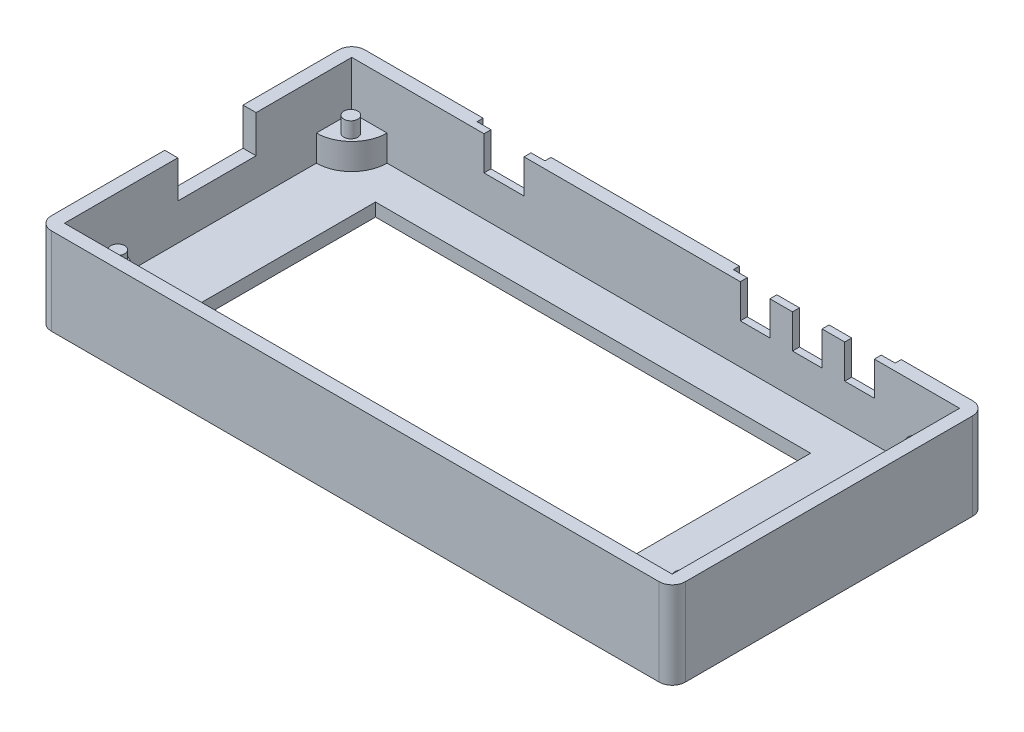
from build123d import *

# Parameters (mm, degrees)
EXTRUDE_1_DEPTH         = 1.5
CUT_EXTRUDE_2_REACH     = 41.107
SKETCH_1_6_W            = 50
SKETCH_1_6_H            = 24.956
EXTRUDE_1_2_OUTLINE_W   = 72.855
EXTRUDE_1_2_OUTLINE_H   = 36.02
EXTRUDE_1_2_OUTLINE_W_2 = 69.855
EXTRUDE_1_2_OUTLINE_H_2 = 33.02
EXTRUDE_1_2_DEPTH       = 10
FILLET_1_R              = 1.5
EXTRUDE_2_DEPTH         = 3
SKETCH_3_R              = 0.8
EXTRUDE_3_DEPTH         = 1.8
CUT_EXTRUDE_3_REACH     = 76.522
SKETCH_4_W              = 9
SKETCH_4_H              = 4.3
CUT_EXTRUDE_4_REACH     = 53.172
SKETCH_5_W              = 3.4
SKETCH_5_H              = 4
SKETCH_5_W_2            = 4.6
CUT_EXTRUDE_START       = -1.5
SKETCH_5_6_W            = 7.8
SKETCH_5_6_H            = 7.2
SKETCH_5_6_W_2          = 18.6
CUT_EXTRUDE_6_DEPTH     = 0.7


# Read off the part's stored shape, not the designer's step: 拉伸-薄壁1
with BuildPart() as part:
    # 草图1 → Extrude 1 (new body)
    with BuildSketch(Plane(origin=(0, 0, 0), x_dir=(1, 0, 0), z_dir=(0, 1, 0))):
        Polygon((-34.9275, 15.494), (34.9275, 15.494), (34.9275, -15.494), (34.9275, -17.526), (-34.9275, -17.526), (-34.9275, -15.494), align=None)
    extrude(amount=EXTRUDE_1_DEPTH)

    # 草图1<6> → 切除-拉伸2 (cut, up to next)
    with BuildSketch(Plane(origin=(0, 0, 0), x_dir=(1, 0, 0), z_dir=(0, 1, 0)), mode=Mode.PRIVATE) as cut_extrude_2_sk1:
        with Locations((-2.6635, -1.516)):
            Rectangle(SKETCH_1_6_W, SKETCH_1_6_H)
    cut_extrude_2_tool1 = extrude(cut_extrude_2_sk1.sketch, amount=CUT_EXTRUDE_2_REACH, mode=Mode.PRIVATE) & part.part
    add(cut_extrude_2_tool1.solids().sort_by_distance((-2.6635, 0, 1.516))[0], mode=Mode.SUBTRACT)



with BuildPart() as body_2:
    # Extrude 1 2 outline → Extrude 1 2 (new body)
    with BuildSketch(Plane(origin=(0, 0, 0), x_dir=(1, 0, 0), z_dir=(0, 1, 0))):
        with Locations((0, -1.016)):
            Rectangle(EXTRUDE_1_2_OUTLINE_W, EXTRUDE_1_2_OUTLINE_H)
        with Locations((0, -1.016)):
            Rectangle(EXTRUDE_1_2_OUTLINE_W_2, EXTRUDE_1_2_OUTLINE_H_2, mode=Mode.SUBTRACT)
    extrude(amount=EXTRUDE_1_2_DEPTH)

    # 圆角1
    fillet_1_edges = [body_2.edges().sort_by_distance(p)[0] for p in [
        (-36.4275, 5, -16.994),
        (-36.4275, 5, 19.026),
        (36.4275, 5, 19.026),
        (36.4275, 5, -16.994),
    ]]
    fillet(fillet_1_edges, radius=FILLET_1_R)


with BuildPart() as part_1:
    add(part.part)

    add(body_2.part)  # 凸台-拉伸2 merges body 2
    # 草图2 → 凸台-拉伸2 (add)
    with BuildSketch(Plane(origin=(0, 1.5, 0), x_dir=(1, 0, 0), z_dir=(0, 1, 0))):
        with BuildLine():
            ThreePointArc((-31.407972759, -17.526), (-31.407972759, -13.462), (-34.9275, -11.43))
            Line((-34.9275, -11.43), (-34.9275, -17.526))
            Line((-34.9275, -17.526), (-31.407972759, -17.526))
        make_face()
        with BuildLine():
            ThreePointArc((-34.9275, 11.43), (-32.053818041, 12.620318041), (-30.8635, 15.494))
            Line((-30.8635, 15.494), (-34.9275, 15.494))
            Line((-34.9275, 15.494), (-34.9275, 11.43))
        make_face()
        with BuildLine():
            Line((34.9275, 15.494), (29.8635, 15.494))
            ThreePointArc((29.8635, 15.494), (31.34671126, 11.91321126), (34.9275, 10.43))
            Line((34.9275, 10.43), (34.9275, 15.494))
        make_face()
        with BuildLine():
            Line((34.9275, -17.526), (34.9275, -10.43))
            ThreePointArc((34.9275, -10.43), (30.688741691, -12.723255696), (30.289065781, -17.526))
            Line((30.289065781, -17.526), (34.9275, -17.526))
        make_face()
    extrude(amount=EXTRUDE_2_DEPTH)

    # 草图3 → 凸台-拉伸3 (add)
    with BuildSketch(Plane(origin=(0, 4.5, 0), x_dir=(1, 0, 0), z_dir=(0, 1, 0))):
        with Locations(Location((-32.9275, -13.394, 0), (0, 0, 270))):
            Circle(SKETCH_3_R)
        with Locations(Location((-32.9275, 13.394, 0), (0, 0, 90))):
            Circle(SKETCH_3_R)
        with Locations(Location((31.9275, -13.394, 0), (0, 0, 90))):
            Circle(SKETCH_3_R)
        with Locations(Location((31.9275, 13.394, 0), (0, 0, 270))):
            Circle(SKETCH_3_R)
    extrude(amount=EXTRUDE_3_DEPTH)

    # 草图4 → 切除-拉伸3 (cut, up to next)
    with BuildSketch(Plane(origin=(-34.9275, 0, 0), x_dir=(0, 0, -1), z_dir=(1, 0, 0)), mode=Mode.PRIVATE) as cut_extrude_3_sk1:
        with Locations((0, 7.85)):
            Rectangle(SKETCH_4_W, SKETCH_4_H)
    cut_extrude_3_tool1 = extrude(cut_extrude_3_sk1.sketch, amount=-CUT_EXTRUDE_3_REACH, mode=Mode.PRIVATE) & part_1.part
    add(cut_extrude_3_tool1.solids().sort_by_distance((-34.9275, 7.85, 0))[0], mode=Mode.SUBTRACT)

    # 草图5 → 切除-拉伸4 (cut, up to next)
    with BuildSketch(Plane.XY.offset(-15.494), mode=Mode.PRIVATE) as cut_extrude_4_sk1:
        with Locations((11.4275, 8.1)):
            Rectangle(SKETCH_5_W, SKETCH_5_H)
    cut_extrude_4_tool1 = extrude(cut_extrude_4_sk1.sketch, amount=-CUT_EXTRUDE_4_REACH, mode=Mode.PRIVATE) & part_1.part
    # 草图5 → 切除-拉伸4 (cut, up to next)
    with BuildSketch(Plane.XY.offset(-15.494), mode=Mode.PRIVATE) as cut_extrude_4_sk2:
        with Locations((17.4275, 8.1)):
            Rectangle(SKETCH_5_W, SKETCH_5_H)
    cut_extrude_4_tool2 = extrude(cut_extrude_4_sk2.sketch, amount=-CUT_EXTRUDE_4_REACH, mode=Mode.PRIVATE) & part_1.part
    # 草图5 → 切除-拉伸4 (cut, up to next)
    with BuildSketch(Plane.XY.offset(-15.494), mode=Mode.PRIVATE) as cut_extrude_4_sk3:
        with Locations((23.4275, 8.1)):
            Rectangle(SKETCH_5_W, SKETCH_5_H)
    cut_extrude_4_tool3 = extrude(cut_extrude_4_sk3.sketch, amount=-CUT_EXTRUDE_4_REACH, mode=Mode.PRIVATE) & part_1.part
    # 草图5 → 切除-拉伸4 (cut, up to next)
    with BuildSketch(Plane.XY.offset(-15.494), mode=Mode.PRIVATE) as cut_extrude_4_sk4:
        with Locations((-17.4275, 8.1)):
            Rectangle(SKETCH_5_W_2, SKETCH_5_H)
    cut_extrude_4_tool4 = extrude(cut_extrude_4_sk4.sketch, amount=-CUT_EXTRUDE_4_REACH, mode=Mode.PRIVATE) & part_1.part
    add(cut_extrude_4_tool1.solids().sort_by_distance((11.4275, 8.1, -15.494))[0], mode=Mode.SUBTRACT)
    add(cut_extrude_4_tool2.solids().sort_by_distance((17.4275, 8.1, -15.494))[0], mode=Mode.SUBTRACT)
    add(cut_extrude_4_tool3.solids().sort_by_distance((23.4275, 8.1, -15.494))[0], mode=Mode.SUBTRACT)
    add(cut_extrude_4_tool4.solids().sort_by_distance((-17.4275, 8.1, -15.494))[0], mode=Mode.SUBTRACT)

    # 草图5<6> → 切除-拉伸6 (cut)
    with BuildSketch(Plane.XY.offset(-15.494).offset(CUT_EXTRUDE_START)):
        with Locations((-17.4275, 8.1)):
            Rectangle(SKETCH_5_6_W, SKETCH_5_6_H)
        with Locations((17.4275, 8.1)):
            Rectangle(SKETCH_5_6_W_2, SKETCH_5_6_H)
    extrude(amount=CUT_EXTRUDE_6_DEPTH, mode=Mode.SUBTRACT)


solid = part_1.part
